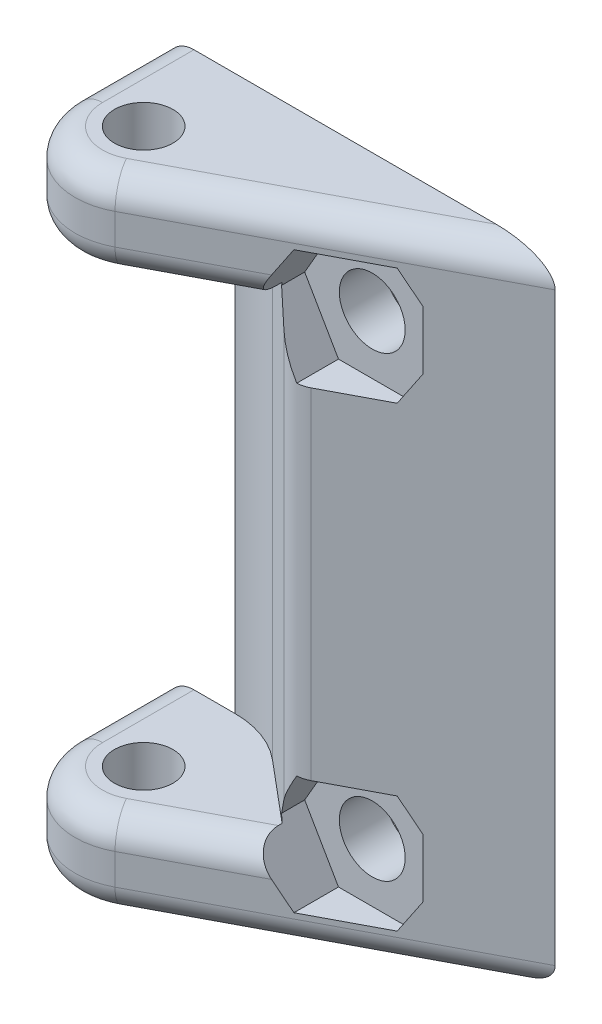
from build123d import *

# Parameters (mm, degrees)
SKETCH1_R           = 2.032
BOSS_EXTRUDE1_DEPTH = 22.225
CUT_EXTRUDE4_DEPTH  = 16.271875
SKETCH13_R          = 2.286
CUT_EXTRUDE9_DEPTH  = 34.3375
CUT_EXTRUDE10_START = -3.175
CUT_EXTRUDE10_DEPTH = 31.1625
FILLET1_R           = 1.905


with BuildPart() as part:
    # Sketch1 → Boss-Extrude1 (new, symmetric)
    with BuildSketch(Plane(origin=(0, 0, 0), x_dir=(1, 0, 0), z_dir=(0, 1, 0))):
        with BuildLine():
            Line((-4.7625, 6.35), (-4.7625, 0))
            ThreePointArc((-4.7625, 0), (-2.458714709, -4.07874101), (2.223800568, -4.211426989))
            Line((2.223800568, -4.211426989), (22.225, 6.35))
            Line((22.225, 6.35), (-4.7625, 6.35))
        make_face()
        Circle(SKETCH1_R, mode=Mode.SUBTRACT)
    extrude(amount=BOSS_EXTRUDE1_DEPTH, both=True)

    # Sketch6 → Cut-Extrude4 (cut, symmetric)
    with BuildSketch(Plane(origin=(0, 0, 0), x_dir=(1, 0, 0), z_dir=(0, 1, 0))):
        with BuildLine():
            Line((0, 6.35), (-4.7625, 6.35))
            Line((-4.7625, 6.35), (-4.7625, 0))
            ThreePointArc((-4.7625, 0), (-2.458714709, -4.07874101), (2.223800568, -4.211426989))
            Line((2.223800568, -4.211426989), (10.002651587, -0.10388497))
            Line((10.002651587, -0.10388497), (4.081701322, 4.864382214))
            ThreePointArc((4.081701322, 4.864382214), (2.17182791, 5.967048142), (0, 6.35))
        make_face()
    extrude(amount=CUT_EXTRUDE4_DEPTH, both=True, mode=Mode.SUBTRACT)

    # Sketch13 → Cut-Extrude9 (cut, through all)
    with BuildSketch(Plane(origin=(0, 0, -6.35), x_dir=(-1, 0, 0), z_dir=(0, 0, -1))):
        with Locations((-12.7, 15.875)):
            Circle(SKETCH13_R)
        with Locations((-12.7, -15.875)):
            Circle(SKETCH13_R)
    extrude(amount=-CUT_EXTRUDE9_DEPTH, mode=Mode.SUBTRACT)

    # Sketch14 → Cut-Extrude10 (cut, through all)
    with BuildSketch(Plane(origin=(0, 0, -6.35), x_dir=(-1, 0, 0), z_dir=(0, 0, -1)).offset(CUT_EXTRUDE10_START)):
        Polygon((-10.353648506, 19.939), (-15.046351494, 19.939), (-17.392702988, 15.875), (-15.046351494, 11.811), (-10.353648506, 11.811), (-8.007297012, 15.875), align=None)
        Polygon((-8.007297012, -15.875), (-10.353648506, -11.811), (-15.046351494, -11.811), (-17.392702988, -15.875), (-15.046351494, -19.939), (-10.353648506, -19.939), align=None)
    extrude(amount=-CUT_EXTRUDE10_DEPTH, mode=Mode.SUBTRACT)

    # Fillet1
    fillet1_edges = [part.edges().sort_by_distance(p)[0] for p in [
        (-4.7625, -22.225, -3.175),
        (-2.458714709, -22.225, 4.07874101),
        (12.224400284, 22.225, -1.069286506),
        (-2.458714709, 22.225, 4.07874101),
        (12.224400284, -22.225, -1.069286506),
        (-4.7625, 22.225, -3.175),
        (-4.7625, -16.271875, -3.175),
        (5.230116734, -16.271875, 2.623972756),
        (-4.7625, 16.271875, -3.175),
        (-2.458714709, 16.271875, 4.07874101),
        (-2.458714709, -16.271875, 4.07874101),
        (5.230116734, 16.271875, 2.623972756),
        (10.002651587, 0, 0.10388497),
    ]]
    fillet(fillet1_edges, radius=FILLET1_R)


solid = part.part
